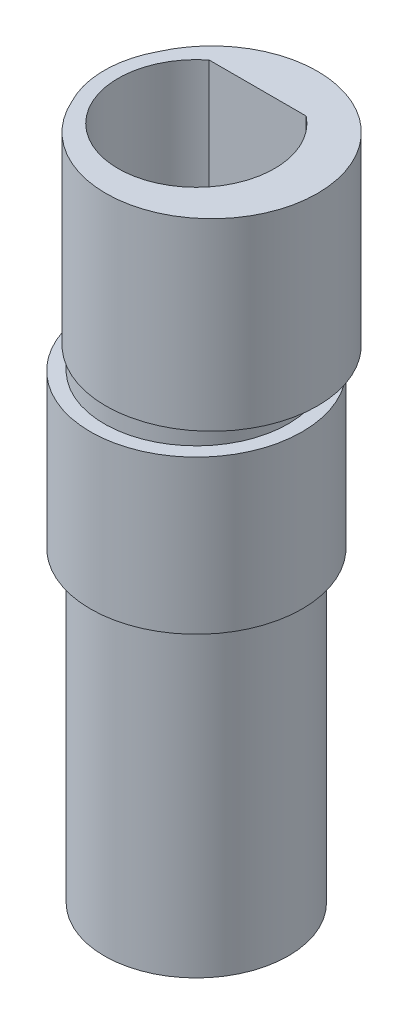
from build123d import *

# Parameters (mm, degrees)
SKETCH1_R                = 3.45
BOSS_EXTRUDE1_DEPTH      = 6
BOSS_EXTRUDE2_DEPTH      = 1
BOSS_EXTRUDE2_DEPTH_BACK = 4
SKETCH2_R                = 3.45
SKETCH3_R                = 3
BOSS_EXTRUDE4_DEPTH      = 22
SKETCH4_R                = 2.55
CUT_EXTRUDE1_DEPTH       = 23.616476295
BOSS_EXTRUDE5_START      = -12.8
BOSS_EXTRUDE5_DEPTH      = 12.8


with BuildPart() as part:
    # Sketch1 → Boss-Extrude1 (new body)
    with BuildSketch(Plane(origin=(0, 0, 0), x_dir=(1, 0, 0), z_dir=(0, 1, 0))):
        Circle(SKETCH1_R)
    extrude(amount=BOSS_EXTRUDE1_DEPTH)



with BuildPart() as body_2:
    # Sketch2 → Boss-Extrude2 (new, two sides: drawn at the far end of the back side and taken through both)
    with BuildSketch(Plane.XZ.offset(4.98).offset(-BOSS_EXTRUDE2_DEPTH_BACK)):
        with Locations((-0.5, 0)):
            Circle(SKETCH2_R)
    extrude(amount=BOSS_EXTRUDE2_DEPTH + BOSS_EXTRUDE2_DEPTH_BACK)


with BuildPart() as part_1:
    add(part.part)

    add(body_2.part)  # Boss-Extrude4 merges body 2
    # Sketch3 → Boss-Extrude4 (add)
    with BuildSketch(Plane(origin=(0, 6, 0), x_dir=(1, 0, 0), z_dir=(0, 1, 0))):
        with Locations((-0.5, 0)):
            Circle(SKETCH3_R)
    extrude(amount=-BOSS_EXTRUDE4_DEPTH)

    # Sketch4 → Cut-Extrude1 (cut, through all)
    with BuildSketch(Plane.XZ.offset(16)):
        with Locations((-0.5, 0)):
            Circle(SKETCH4_R)
    extrude(amount=-CUT_EXTRUDE1_DEPTH, mode=Mode.SUBTRACT)

    # Sketch5 → Boss-Extrude5 (add)
    with BuildSketch(Plane(origin=(0, 6, 0), x_dir=(1, 0, 0), z_dir=(0, 1, 0)).offset(BOSS_EXTRUDE5_START)):
        with BuildLine():
            Line((-2.081929202, 2), (1.081929202, 2))
            ThreePointArc((1.081929202, 2), (-0.5, 2.55), (-2.081929202, 2))
        make_face()
    extrude(amount=BOSS_EXTRUDE5_DEPTH)


solid = part_1.part
